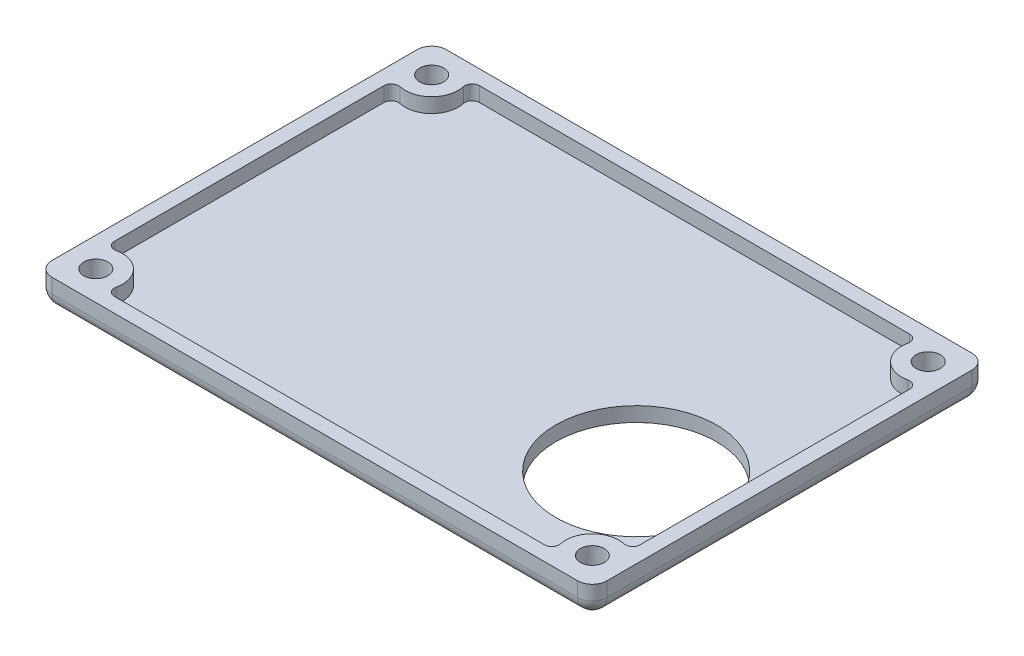
from build123d import *

# Parameters (mm, degrees)
SCHIZZO1_W                   = 76
SCHIZZO1_H                   = 54
ESTRUSIONE_ESTRUSIONE1_DEPTH = 4
SCHIZZO2_W                   = 72
SCHIZZO2_H                   = 50
TAGLIO_ESTRUSIONE1_DEPTH     = 2
SCHIZZO3_R                   = 3.65
SCHIZZO3_R_2                 = 1.65
ESTRUSIONE_ESTRUSIONE2_DEPTH = 2
SCHIZZO3_11_R                = 1.65
TAGLIO_ESTRUSIONE4_DEPTH     = 47.658332589
SCHIZZO5_R                   = 11
TAGLIO_ESTRUSIONE5_DEPTH     = 2
RACCORDO1_R                  = 2
RACCORDO2_R                  = 1


with BuildPart() as part:
    # Schizzo1 → Estrusione-Estrusione1 (new body)
    with BuildSketch(Plane(origin=(0, 0, 0), x_dir=(1, 0, 0), z_dir=(0, 1, 0))):
        Rectangle(SCHIZZO1_W, SCHIZZO1_H)
    extrude(amount=ESTRUSIONE_ESTRUSIONE1_DEPTH)

    # Schizzo2 → Taglio-Estrusione1 (cut)
    with BuildSketch(Plane(origin=(0, 4, 0), x_dir=(1, 0, 0), z_dir=(0, 1, 0))):
        Rectangle(SCHIZZO2_W, SCHIZZO2_H)
    extrude(amount=-TAGLIO_ESTRUSIONE1_DEPTH, mode=Mode.SUBTRACT)

    # Schizzo3 → Estrusione-Estrusione2 (add)
    # profile 1 of 4: a face of its own
    with BuildSketch(Plane(origin=(0, 2, 0), x_dir=(1, 0, 0), z_dir=(0, 1, 0))):
        with Locations((34, 23)):
            Circle(SCHIZZO3_R)
        with Locations(Location((34, 23, 0), (0, 0, 270))):
            Circle(SCHIZZO3_R_2, mode=Mode.SUBTRACT)
    # profile 2 of 4: a face of its own
    with BuildSketch(Plane(origin=(0, 2, 0), x_dir=(1, 0, 0), z_dir=(0, 1, 0))):
        with Locations((-34, 23)):
            Circle(SCHIZZO3_R)
        with Locations(Location((-34, 23, 0), (0, 0, 270))):
            Circle(SCHIZZO3_R_2, mode=Mode.SUBTRACT)
    # profile 3 of 4: a face of its own
    with BuildSketch(Plane(origin=(0, 2, 0), x_dir=(1, 0, 0), z_dir=(0, 1, 0))):
        with Locations((34, -23)):
            Circle(SCHIZZO3_R)
        with Locations(Location((34, -23, 0), (0, 0, 270))):
            Circle(SCHIZZO3_R_2, mode=Mode.SUBTRACT)
    # profile 4 of 4: a face of its own
    with BuildSketch(Plane(origin=(0, 2, 0), x_dir=(1, 0, 0), z_dir=(0, 1, 0))):
        with Locations((-34, -23)):
            Circle(SCHIZZO3_R)
        with Locations(Location((-34, -23, 0), (0, 0, 270))):
            Circle(SCHIZZO3_R_2, mode=Mode.SUBTRACT)
    extrude(amount=ESTRUSIONE_ESTRUSIONE2_DEPTH)

    # Schizzo3<11> → Taglio-Estrusione4 (cut, through all)
    with BuildSketch(Plane(origin=(0, 2, 0), x_dir=(1, 0, 0), z_dir=(0, 1, 0))):
        with Locations(Location((-34, 23, 0), (0, 0, 270))):
            Circle(SCHIZZO3_11_R)
        with Locations(Location((-34, -23, 0), (0, 0, 270))):
            Circle(SCHIZZO3_11_R)
        with Locations(Location((34, -23, 0), (0, 0, 270))):
            Circle(SCHIZZO3_11_R)
        with Locations(Location((34, 23, 0), (0, 0, 270))):
            Circle(SCHIZZO3_11_R)
    extrude(amount=-TAGLIO_ESTRUSIONE4_DEPTH, mode=Mode.SUBTRACT)

    # Schizzo5 → Taglio-Estrusione5 (cut)
    with BuildSketch(Plane.XZ):
        with Locations(Location((25, 8, 0), (0, 0, 270))):
            Circle(SCHIZZO5_R)
    extrude(amount=-TAGLIO_ESTRUSIONE5_DEPTH, mode=Mode.SUBTRACT)

    # Raccordo1
    raccordo1_edges = [part.edges().sort_by_distance(p)[0] for p in [
        (0, 0, 27),
        (-38, 0, 0),
        (0, 0, -27),
        (38, 0, 0),
        (38, 2, 27),
        (-38, 2, 27),
        (-38, 2, -27),
        (38, 2, -27),
    ]]
    fillet(raccordo1_edges, radius=RACCORDO1_R - 0.0001)  # a hair under: the kernel refuses the full size

    # Raccordo2
    raccordo2_edges = [part.edges().sort_by_distance(p)[0] for p in [
        (30.946723072, 3, -25),
        (36, 3, -19.946723072),
        (-36, 3, -19.946723072),
        (-30.946723072, 3, -25),
        (-30.946723072, 3, 25),
        (-36, 3, 19.946723072),
        (36, 3, 19.946723072),
        (30.946723072, 3, 25),
    ]]
    fillet(raccordo2_edges, radius=RACCORDO2_R)


solid = part.part
